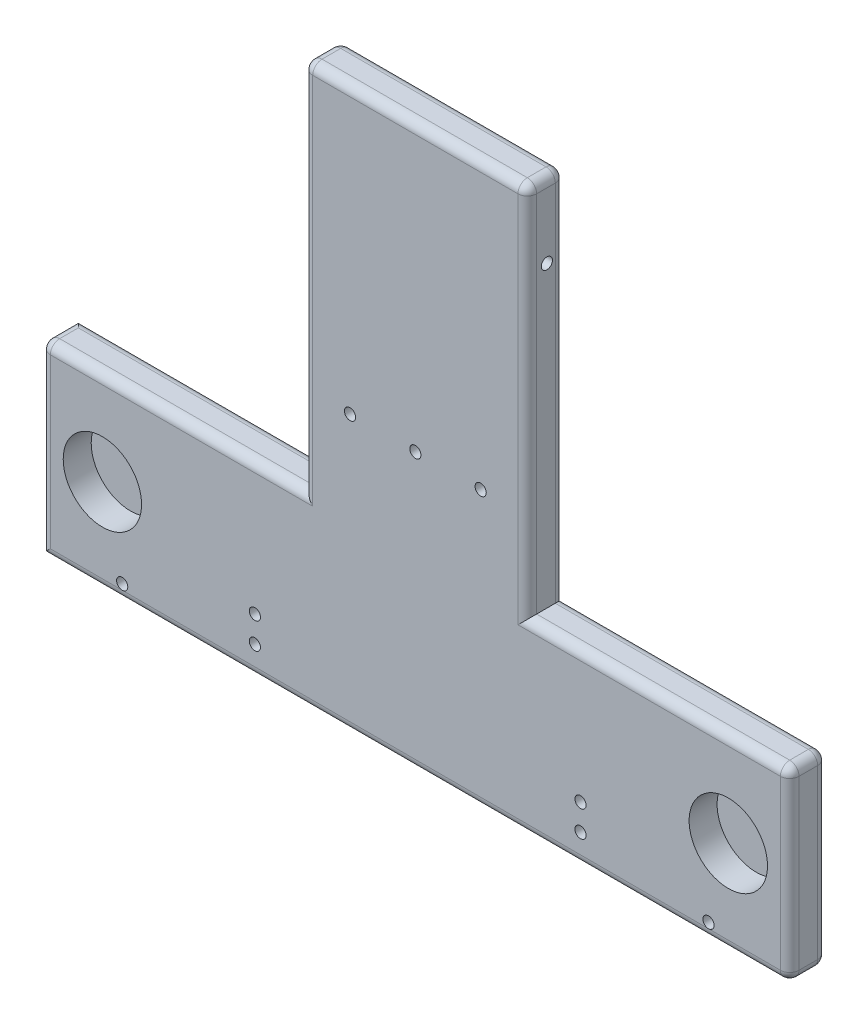
from build123d import *

# Parameters (mm, degrees)
BOSS_EXTRUDE1_DEPTH = 20
SKETCH2_R           = 21
CUT_EXTRUDE1_DEPTH  = 15
SKETCH3_R           = 3
CUT_EXTRUDE2_DEPTH  = 8
SKETCH4_R           = 3
CUT_EXTRUDE3_DEPTH  = 15
SKETCH5_R           = 3
CUT_EXTRUDE4_DEPTH  = 20
FILLET1_R           = 5
SKETCH6_R           = 3
CUT_EXTRUDE7_DEPTH  = 10


with BuildPart() as part:
    # Sketch1 → Boss-Extrude1 (new body)
    with BuildSketch(Plane.XY):
        Polygon((-200.6, -50), (200.6, -50), (200.6, 50), (60, 50), (60, 250), (-60, 250), (-60, 50), (-200.6, 50), align=None)
    extrude(amount=BOSS_EXTRUDE1_DEPTH)

    # Sketch2 → Cut-Extrude1 (cut)
    with BuildSketch(Plane.XY.offset(20)):
        with Locations((167.7, 0)):
            Circle(SKETCH2_R)
        with Locations(Location((-167.7, 0, 0), (0, 0, 180))):
            Circle(SKETCH2_R)
    extrude(amount=-CUT_EXTRUDE1_DEPTH, mode=Mode.SUBTRACT)

    # Sketch3 → Cut-Extrude2 (cut)
    with BuildSketch(Plane.XY.offset(20)):
        with Locations((-35, 97.753157488)):
            Circle(SKETCH3_R)
        with Locations((35, 97.753157488)):
            Circle(SKETCH3_R)
        with Locations((0, 97.753157488)):
            Circle(SKETCH3_R)
    extrude(amount=-CUT_EXTRUDE2_DEPTH, mode=Mode.SUBTRACT)

    # Sketch4 → Cut-Extrude3 (cut)
    with BuildSketch(Plane.XY.offset(20)):
        with Locations((-86, -20.5)):
            Circle(SKETCH4_R)
        with Locations((88.5, -20.5)):
            Circle(SKETCH4_R)
        with Locations((88.5, -34.5)):
            Circle(SKETCH4_R)
        with Locations((-86, -34.5)):
            Circle(SKETCH4_R)
    extrude(amount=-CUT_EXTRUDE3_DEPTH, mode=Mode.SUBTRACT)

    # Sketch5 → Cut-Extrude4 (cut)
    with BuildSketch(Plane.XY.offset(20)):
        with Locations((157.08787293, -42)):
            Circle(SKETCH5_R)
    cut_extrude4 = extrude(amount=-CUT_EXTRUDE4_DEPTH, mode=Mode.SUBTRACT)

    # Mirror2: Cut-Extrude4 across plane
    add(cut_extrude4.mirror(Plane(origin=(0, 0, 0), x_dir=(0, 0, 1), z_dir=(1, 0, 0))), mode=Mode.SUBTRACT)

    # Fillet1
    fillet1_edges = [part.edges().sort_by_distance(p)[0] for p in [
        (-60, 150, 0),
        (0, 250, 0),
        (60, 150, 0),
        (130.3, 50, 0),
        (0, 250, 20),
        (200.6, 50, 10),
        (200.6, -50, 10),
        (-200.6, 50, 10),
        (-60, 250, 10),
        (60, 250, 10),
        (-60, 150, 20),
        (-130.3, 50, 20),
        (-200.6, 0, 20),
        (0, -50, 20),
        (200.6, 0, 20),
        (130.3, 50, 20),
        (200.6, 0, 0),
        (60, 150, 20),
        (0, -50, 0),
        (-130.3, 50, 0),
    ]]
    fillet(fillet1_edges, radius=FILLET1_R - 0.0001)  # a hair under: the kernel refuses the full size

    # Sketch6 → Cut-Extrude7 (cut)
    with BuildSketch(Plane.ZY.offset(60)):
        with Locations(Location((9.525, 210, 0), (0, 0, 270))):
            Circle(SKETCH6_R)
    cut_extrude7 = extrude(amount=-CUT_EXTRUDE7_DEPTH, mode=Mode.SUBTRACT)

    # Mirror3: Cut-Extrude7 across plane
    add(cut_extrude7.mirror(Plane(origin=(0, 0, 0), x_dir=(0, 0, 1), z_dir=(1, 0, 0))), mode=Mode.SUBTRACT)


solid = part.part
